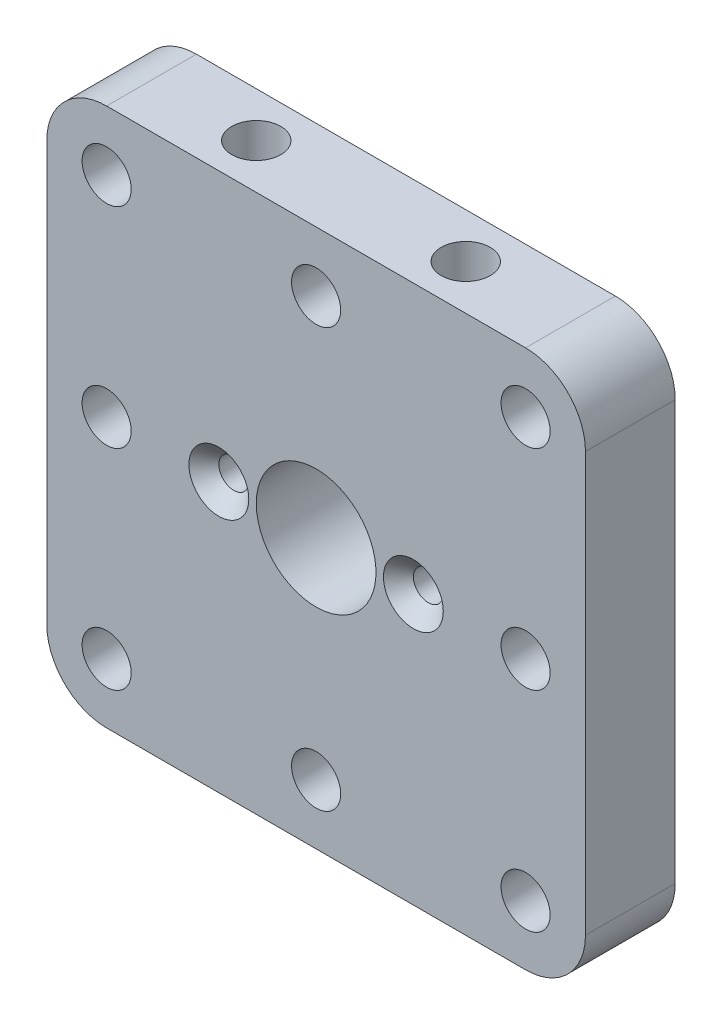
from build123d import *

# Parameters (mm, degrees)
SKETCH1_W           = 57.15
SKETCH1_H           = 57.15
SKETCH1_R           = 2.6035
SKETCH1_R_2         = 6.35
SKETCH1_R_3         = 1.5875
BOSS_EXTRUDE1_DEPTH = 9.525
CHAMFER1_SIZE       = 1.5875
FILLET1_R           = 6.35
SKETCH2_R           = 2.6035
CUT_EXTRUDE1_DEPTH  = 12.7


with BuildPart() as part:
    # Sketch1 → Boss-Extrude1 (new body)
    with BuildSketch(Plane.XY.offset(579.576994876)):
        with Locations((0, 762.756140976)):
            Rectangle(SKETCH1_W, SKETCH1_H)
        with Locations((-22.225, 784.981140976)):
            Circle(SKETCH1_R, mode=Mode.SUBTRACT)
        with Locations((0, 762.756140976)):
            Circle(SKETCH1_R_2, mode=Mode.SUBTRACT)
        with Locations((-10.31875, 762.756140976)):
            Circle(SKETCH1_R_3, mode=Mode.SUBTRACT)
        with Locations((10.31875, 762.756140976)):
            Circle(SKETCH1_R_3, mode=Mode.SUBTRACT)
        with Locations((22.225, 784.981140976)):
            Circle(SKETCH1_R, mode=Mode.SUBTRACT)
        with Locations((22.225, 762.756140976)):
            Circle(SKETCH1_R, mode=Mode.SUBTRACT)
        with Locations((0, 784.981140976)):
            Circle(SKETCH1_R, mode=Mode.SUBTRACT)
        with Locations((-22.225, 762.756140976)):
            Circle(SKETCH1_R, mode=Mode.SUBTRACT)
        with Locations((22.225, 740.531140976)):
            Circle(SKETCH1_R, mode=Mode.SUBTRACT)
        with Locations((0, 740.531140976)):
            Circle(SKETCH1_R, mode=Mode.SUBTRACT)
        with Locations((-22.225, 740.531140976)):
            Circle(SKETCH1_R, mode=Mode.SUBTRACT)
    extrude(amount=BOSS_EXTRUDE1_DEPTH)

    # Chamfer1
    chamfer1_edges = [part.edges().sort_by_distance(p)[0] for p in [
        (8.73125, 762.756140976, 589.101994876),
        (-11.90625, 762.756140976, 589.101994876),
    ]]
    chamfer(chamfer1_edges, length=CHAMFER1_SIZE)

    # Fillet1
    fillet1_edges = [part.edges().sort_by_distance(p)[0] for p in [
        (28.575, 734.181140976, 584.339494876),
        (28.575, 791.331140976, 584.339494876),
        (-28.575, 791.331140976, 584.339494876),
        (-28.575, 734.181140976, 584.339494876),
    ]]
    fillet(fillet1_edges, radius=FILLET1_R)

    # Sketch2 → Cut-Extrude1 (cut)
    with BuildSketch(Plane(origin=(0, 791.331140976, 0), x_dir=(1, 0, 0), z_dir=(0, 1, 0))):
        with Locations((-11.1125, -584.339494876)):
            Circle(SKETCH2_R)
        with Locations((11.1125, -584.339494876)):
            Circle(SKETCH2_R)
    extrude(amount=-CUT_EXTRUDE1_DEPTH, mode=Mode.SUBTRACT)


solid = part.part
